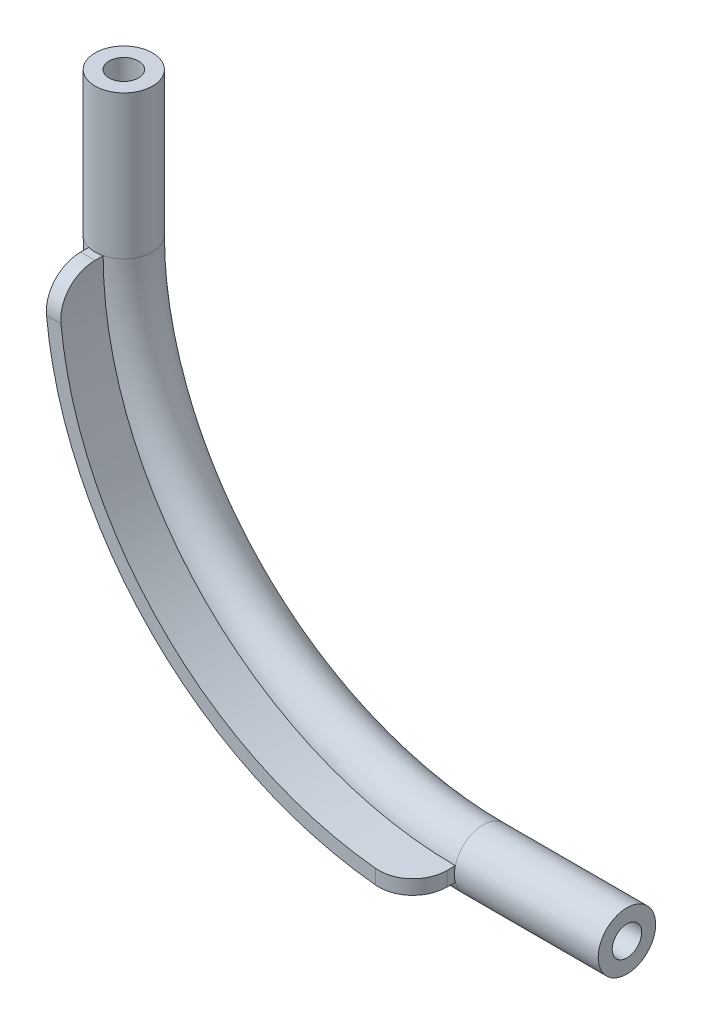
from build123d import *

# Parameters (mm, degrees)
SKETCH_4_R      = 4
REVOLVE_1_ANGLE = 90
SKETCH_5_R      = 4
SKETCH_5_R_2    = 2.05
EXTRUDE_4_DEPTH = 20
SKETCH_6_R      = 4
SKETCH_6_R_2    = 2.05
EXTRUDE_5_DEPTH = 20
EXTRUDE_6_DEPTH = 10
FILLET_1_R      = 5


with BuildPart() as part:
    # 草圖4 → 旋轉1 (revolve)
    with BuildSketch(Plane(origin=(0, 0, 0), x_dir=(1, 0, 0), z_dir=(0, 1, 0))):
        with Locations((-50, 0)):
            Circle(SKETCH_4_R)
    revolve(axis=Axis((0, 0, -3.474942085), (0, 0, 1)), revolution_arc=REVOLVE_1_ANGLE)

    # 草圖5 → 填料-伸長4 (add)
    with BuildSketch(Plane(origin=(0, 0, 0), x_dir=(0, 0, -1), z_dir=(1, 0, 0))):
        with Locations((0, -50)):
            Circle(SKETCH_5_R)
        with Locations((0, -50)):
            Circle(SKETCH_5_R_2, mode=Mode.SUBTRACT)
    extrude(amount=EXTRUDE_4_DEPTH)

    # 草圖6 → 填料-伸長5 (add)
    with BuildSketch(Plane(origin=(0, 0, 0), x_dir=(1, 0, 0), z_dir=(0, 1, 0))):
        with Locations((-50, 0)):
            Circle(SKETCH_6_R)
        with Locations((-50, 0)):
            Circle(SKETCH_6_R_2, mode=Mode.SUBTRACT)
    extrude(amount=EXTRUDE_5_DEPTH)

    # 草圖7 → 填料-伸長6 (add)
    with BuildSketch(Plane.XY):
        with BuildLine():
            Line((-49, 0), (-51, 0))
            ThreePointArc((-51, 0), (-36.062445841, -36.062445841), (0, -51))
            Line((0, -51), (0, -49))
            ThreePointArc((0, -49), (-34.648232278, -34.648232278), (-49, 0))
        make_face()
    extrude(amount=EXTRUDE_6_DEPTH)

    # 圓角1
    fillet_1_edges = [part.edges().sort_by_distance(p)[0] for p in [
        (0, -50, 10),
        (-50, 0, 10),
    ]]
    fillet(fillet_1_edges, radius=FILLET_1_R)


solid = part.part
